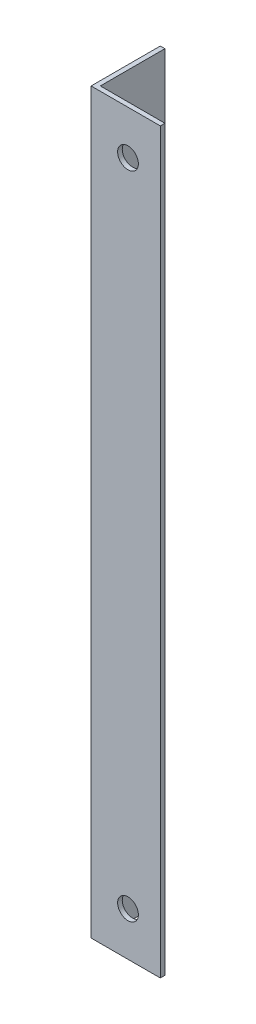
from build123d import *

# Parameters (mm, degrees)
EXTRUDE_1_DEPTH     = 160
SKETCH_2_R          = 2.25
CUT_EXTRUDE_1_DEPTH = 162.310260058
SKETCH_4_R          = 2.25
CUT_EXTRUDE_3_DEPTH = 162.310260058


with BuildPart() as part:
    # Эскиз1 → Бобышка-Вытянуть1 (new body)
    with BuildSketch(Plane(origin=(0, 0, 0), x_dir=(1, 0, 0), z_dir=(0, 1, 0))):
        Polygon((0, 0), (0, 15), (1, 15), (1, 1), (15, 1), (15, 0), align=None)
    extrude(amount=EXTRUDE_1_DEPTH)

    # Эскиз2 → Вырез-Вытянуть1 (cut, through all)
    with BuildSketch(Plane(origin=(0, 0, -1), x_dir=(-1, 0, 0), z_dir=(0, 0, -1))):
        with Locations((-8, 9.5)):
            Circle(SKETCH_2_R)
    extrude(amount=-CUT_EXTRUDE_1_DEPTH, mode=Mode.SUBTRACT)

    # Эскиз4 → Вырез-Вытянуть3 (cut, through all)
    with BuildSketch(Plane(origin=(0, 0, -1), x_dir=(-1, 0, 0), z_dir=(0, 0, -1))):
        with Locations((-8, 150.5)):
            Circle(SKETCH_4_R)
    extrude(amount=-CUT_EXTRUDE_3_DEPTH, mode=Mode.SUBTRACT)


solid = part.part
